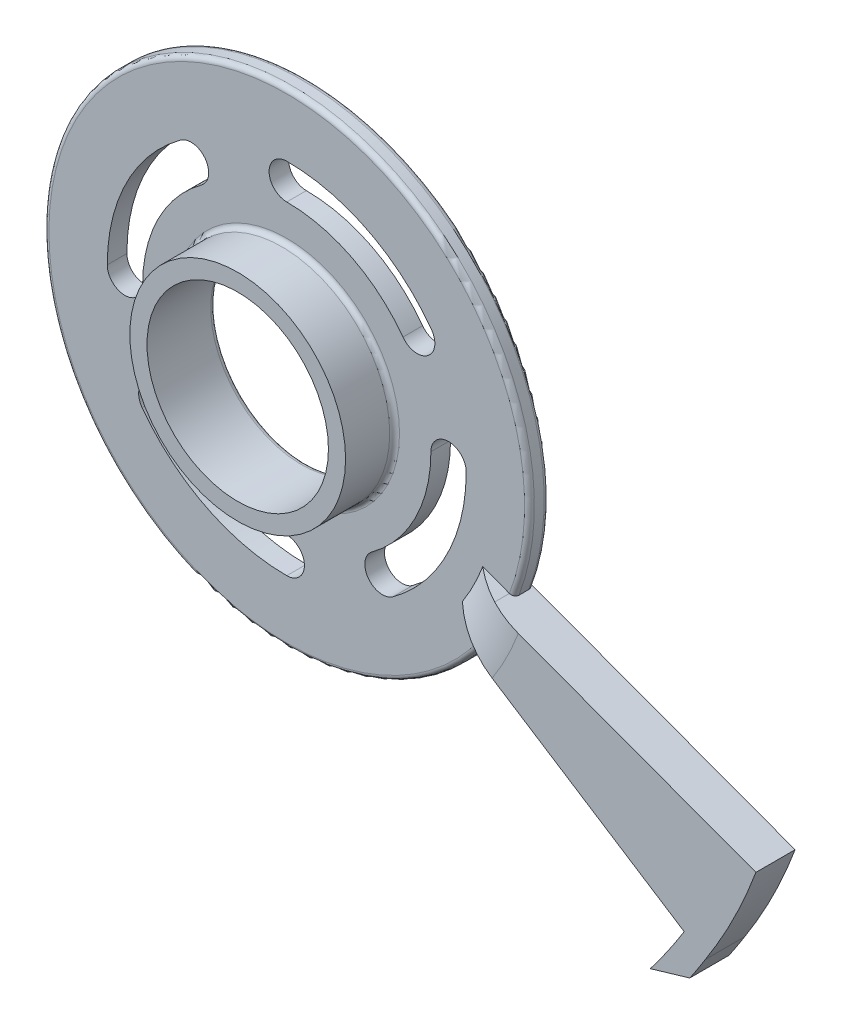
from build123d import *

# Parameters (mm, degrees)
SKETCH3_R                = 24.75
BOSS_EXTRUDE3_DEPTH      = 2
SKETCH7_R                = 9.25
CUT_EXTRUDE2_DEPTH       = 2
BOSS_EXTRUDE6_START      = 5
SKETCH8_R                = 11
SKETCH8_R_2              = 9.25
BOSS_EXTRUDE6_DEPTH      = 5
FILLET31_R               = 0.5
FILLET32_R               = 0.5
CUT_EXTRUDE7_DEPTH       = 2
BOSS_EXTRUDE8_DEPTH      = 2
BOSS_EXTRUDE8_DEPTH_BACK = 2
CUT_EXTRUDE9_START       = -2
CUT_EXTRUDE9_DEPTH       = 2
CUT_EXTRUDE10_START      = -2
CUT_EXTRUDE10_DEPTH      = 2
FILLET33_R               = 0.5
FILLET34_R               = 0.5
CUT_EXTRUDE11_DEPTH      = 4
BOSS_EXTRUDE10_DEPTH     = 4
BOSS_EXTRUDE14_START     = -4
BOSS_EXTRUDE14_DEPTH     = 4
BOSS_EXTRUDE16_DEPTH     = 4
BOSS_EXTRUDE18_DEPTH     = 2
FILLET36_R               = 10
BOSS_EXTRUDE22_DEPTH     = 4


with BuildPart() as part:
    # Sketch3 → Boss-Extrude3 (new body)
    with BuildSketch(Plane.XY):
        Circle(SKETCH3_R)
    extrude(amount=BOSS_EXTRUDE3_DEPTH)

    # Sketch7 → Cut-Extrude2 (cut)
    with BuildSketch(Plane.XY.offset(2)):
        Circle(SKETCH7_R)
    extrude(amount=-CUT_EXTRUDE2_DEPTH, mode=Mode.SUBTRACT)

    # Sketch8 → Boss-Extrude6 (add)
    with BuildSketch(Plane.XY.offset(2).offset(BOSS_EXTRUDE6_START)):
        Circle(SKETCH8_R)
        Circle(SKETCH8_R_2, mode=Mode.SUBTRACT)
    extrude(amount=-BOSS_EXTRUDE6_DEPTH)

    # Fillet31
    fillet31_edges = [part.edges().sort_by_distance(p)[0] for p in [
        (-24.75, 0, 0),
        (-9.25, 0, 0),
    ]]
    fillet(fillet31_edges, radius=FILLET31_R)

    # Fillet32
    fillet32_edges = [part.edges().sort_by_distance(p)[0] for p in [
        (-11, 0, 2),
        (-24.75, 0, 2),
    ]]
    fillet(fillet32_edges, radius=FILLET32_R)

    # Sketch4 → Cut-Extrude7 (cut)
    with BuildSketch(Plane.XY.offset(2)):
        with BuildLine():
            ThreePointArc((-14.7, 0), (-16.5, -1.8), (-18.3, 0))
            ThreePointArc((-18.3, 0), (-16.325580278, 8.268338925), (-10.828368461, 14.752506108))
            ThreePointArc((-10.828368461, 14.752506108), (-8.312216864, 14.366525356), (-8.698197616, 11.850373759))
            ThreePointArc((-8.698197616, 11.850373759), (-13.113990715, 6.641780448), (-14.7, 0))
        make_face()
        with BuildLine():
            ThreePointArc((0, -14.7), (1.8, -16.5), (0, -18.3))
            ThreePointArc((0, -18.3), (-8.268338925, -16.325580278), (-14.752506108, -10.828368461))
            ThreePointArc((-14.752506108, -10.828368461), (-14.366525356, -8.312216864), (-11.850373759, -8.698197616))
            ThreePointArc((-11.850373759, -8.698197616), (-6.641780448, -13.113990715), (0, -14.7))
        make_face()
        with BuildLine():
            ThreePointArc((14.7, 0), (16.5, 1.8), (18.3, 0))
            ThreePointArc((18.3, 0), (16.325580278, -8.268338925), (10.828368461, -14.752506108))
            ThreePointArc((10.828368461, -14.752506108), (8.312216864, -14.366525356), (8.698197616, -11.850373759))
            ThreePointArc((8.698197616, -11.850373759), (13.113990715, -6.641780448), (14.7, 0))
        make_face()
        with BuildLine():
            ThreePointArc((0, 14.7), (-1.8, 16.5), (0, 18.3))
            ThreePointArc((0, 18.3), (8.268338925, 16.325580278), (14.752506108, 10.828368461))
            ThreePointArc((14.752506108, 10.828368461), (14.366525356, 8.312216864), (11.850373759, 8.698197616))
            ThreePointArc((11.850373759, 8.698197616), (6.641780448, 13.113990715), (0, 14.7))
        make_face()
    extrude(amount=-CUT_EXTRUDE7_DEPTH, mode=Mode.SUBTRACT)

    # Sketch13 → Boss-Extrude8 (add, two sides: drawn at the far end of the back side and taken through both)
    with BuildSketch(Plane.XY.offset(2).offset(-BOSS_EXTRUDE8_DEPTH_BACK)):
        with BuildLine():
            Line((38.819540025, -30.398089039), (19.877333475, -13.890792415))
            ThreePointArc((19.877333475, -13.890792415), (21.459544814, -11.29382293), (22.704291658, -8.519251158))
            Line((22.704291658, -8.519251158), (47.195410326, -17.604918534))
            ThreePointArc((47.195410326, -17.604918534), (43.423669833, -24.273992336), (38.819540025, -30.398089039))
        make_face()
    extrude(amount=BOSS_EXTRUDE8_DEPTH + BOSS_EXTRUDE8_DEPTH_BACK)

    # Sketch14 → Cut-Extrude9 (cut)
    with BuildSketch(Plane.XY.offset(4).offset(CUT_EXTRUDE9_START)):
        with BuildLine():
            Line((19.850553041, -13.867978765), (38.819540025, -30.398089039))
            ThreePointArc((38.819540025, -30.398089039), (40.286694805, -28.620798349), (41.683322514, -26.787567215))
            Line((41.683322514, -26.787567215), (20.371088677, -13.091372623))
            ThreePointArc((20.371088677, -13.091372623), (20.11456922, -13.482188107), (19.850553041, -13.867978765))
        make_face()
    extrude(amount=CUT_EXTRUDE9_DEPTH, mode=Mode.SUBTRACT)

    # Sketch15 → Cut-Extrude10 (cut)
    with BuildSketch(Plane.XY.offset(2).offset(CUT_EXTRUDE10_START)):
        with BuildLine():
            Line((38.819540025, -30.398089039), (20.256402439, -14.22113428))
            ThreePointArc((20.256402439, -14.22113428), (20.514190977, -13.846677166), (20.765058212, -13.467548308))
            Line((20.765058212, -13.467548308), (41.683322514, -26.787567215))
            ThreePointArc((41.683322514, -26.787567215), (40.286694805, -28.620798349), (38.819540025, -30.398089039))
        make_face()
    extrude(amount=CUT_EXTRUDE10_DEPTH, mode=Mode.SUBTRACT)

    # Fillet33
    # the kernel refuses this fillet: 0.5 mm, written as the material it takes off along each edge
    with BuildSketch(Plane(origin=(0, 0, 2), x_dir=(0.7883894686157571, -0.6151764346720087, 0), z_dir=(-0.6151764346720087, -0.7883894686157571, 0))) as fillet33_piece_1_section:
        with BuildLine():
            CenterArc((24.75 - FILLET33_R, -FILLET33_R), FILLET33_R, 0, 90)
            Line((24.75 - FILLET33_R, 0), (24.75, 0))
            Line((24.75, 0), (24.75, -FILLET33_R))
        make_face()
    fillet33_piece_1 = revolve(axis=Axis((0, 0, 2), (0, 0, 1)), revolution_arc=7.892324656, mode=Mode.PRIVATE)
    fillet33_piece_1 = split(fillet33_piece_1, bisect_by=Plane(origin=(20.636081205, -13.385420262, 1.886497018), z_dir=(-0.5371164504415562, -0.8435081023114498, 0)), keep=Keep.TOP, mode=Mode.PRIVATE)
    add(fillet33_piece_1, mode=Mode.SUBTRACT)

    # Fillet34
    # the kernel refuses this fillet: 0.5 mm, written as the material it takes off along each edge
    with BuildSketch(Plane(origin=(0, 0, 0), x_dir=(0.7883894686157571, -0.6151764346720087, 0), z_dir=(-0.6151764346720087, -0.7883894686157571, 0))) as fillet34_piece_1_section:
        with BuildLine():
            CenterArc((24.75 - FILLET34_R, FILLET34_R), FILLET34_R, 270, 90)
            Line((24.75, FILLET34_R), (24.75, 0))
            Line((24.75, 0), (24.75 - FILLET34_R, 0))
        make_face()
    fillet34_piece_1 = revolve(axis=Axis((0, 0, 0), (0, 0, 1)), revolution_arc=7.892324656, mode=Mode.PRIVATE)
    fillet34_piece_1 = split(fillet34_piece_1, bisect_by=Plane(origin=(20.636080982, -13.38542012, 0.113502928), z_dir=(-0.5371164504415562, -0.8435081023114498, 0)), keep=Keep.TOP, mode=Mode.PRIVATE)
    add(fillet34_piece_1, mode=Mode.SUBTRACT)

    # Sketch16 → Cut-Extrude11 (cut)
    with BuildSketch(Plane(origin=(0, 0, 0), x_dir=(-1, 0, 0), z_dir=(0, 0, -1))):
        with BuildLine():
            Line((-46.768831726, -17.446667238), (-47.195410326, -17.604918534))
            ThreePointArc((-47.195410326, -17.604918534), (-45.975373397, -19.992187587), (-44.648150349, -22.321570042))
            ThreePointArc((-44.648150349, -22.321570042), (-45.773434679, -19.912370438), (-46.768831726, -17.446667238))
        make_face()
    extrude(amount=-CUT_EXTRUDE11_DEPTH, mode=Mode.SUBTRACT)

    # Sketch17 → Boss-Extrude10 (add)
    with BuildSketch(Plane(origin=(0, 0, 0), x_dir=(-1, 0, 0), z_dir=(0, 0, -1))):
        with BuildLine():
            Line((-41.680315567, -26.785634817), (-41.99318774, -26.986700468))
            ThreePointArc((-41.99318774, -26.986700468), (-43.383421107, -24.68984795), (-44.648150349, -22.321570042))
            ThreePointArc((-44.648150349, -22.321570042), (-43.21497039, -24.587334089), (-41.680315567, -26.785634817))
        make_face()
    extrude(amount=-BOSS_EXTRUDE10_DEPTH)

    # Sketch18 → Boss-Extrude14 (add)
    with BuildSketch(Plane.XY.offset(4).offset(BOSS_EXTRUDE14_START)):
        with BuildLine():
            Line((41.99318774, -26.986700468), (44.742327082, -28.753420356))
            ThreePointArc((44.742327082, -28.753420356), (47.558806026, -23.807456483), (49.830614891, -18.588836286))
            Line((49.830614891, -18.588836286), (46.768831726, -17.446667238))
            ThreePointArc((46.768831726, -17.446667238), (44.636611469, -22.344635492), (41.99318774, -26.986700468))
        make_face()
    extrude(amount=BOSS_EXTRUDE14_DEPTH)

    # Sketch23 → Boss-Extrude16 (add)
    with BuildSketch(Plane(origin=(0, 0, 0), x_dir=(-1, 0, 0), z_dir=(0, 0, -1))):
        with BuildLine():
            Line((-22.705248166, -8.516701574), (-49.833635263, -18.580737641))
            ThreePointArc((-49.833635263, -18.580737641), (-47.534188111, -23.856570908), (-44.678139851, -28.853055892))
            Line((-44.678139851, -28.853055892), (-20.3362292, -13.209855485))
            ThreePointArc((-20.3362292, -13.209855485), (-21.648293625, -10.92766595), (-22.705248166, -8.516701574))
        make_face()
    extrude(amount=-BOSS_EXTRUDE16_DEPTH)

    # Sketch24 → Boss-Extrude18 (add)
    with BuildSketch(Plane.XY.offset(2)):
        with BuildLine():
            Line((22.705248166, -8.516701574), (19.989482511, -7.498022304))
            ThreePointArc((19.989482511, -7.498022304), (19.05894988, -9.620612195), (17.903820956, -11.629829952))
            Line((17.903820956, -11.629829952), (20.3362292, -13.209855485))
            ThreePointArc((20.3362292, -13.209855485), (21.648293625, -10.92766595), (22.705248166, -8.516701574))
        make_face()
    extrude(amount=BOSS_EXTRUDE18_DEPTH)

    # Fillet36
    # the kernel refuses this fillet: 10 mm, written as the material it takes off along each edge
    with BuildSketch(Plane(origin=(0, 0, 4), x_dir=(0.9415001146700814, 0.3370126615963019, 0), z_dir=(-0.3370126615963019, 0.9415001146700814, 0))) as fillet36_piece_1:
        with BuildLine():
            CenterArc((27.349467195, 10), FILLET36_R, 233.130102354, 36.869897646)
            Line((21.349467195, 2), (21.229467195, 1.84))
            ThreePointArc((21.229467195, 1.84), (21.149467195, 1), (21.149467195, 0))
            Line((21.149467195, 0), (21.349467195, -0.2))
            Line((21.349467195, -0.2), (27.349467195, -0.2))
            Line((27.349467195, -0.2), (27.349467195, 0))
        make_face()
    revolve(axis=Axis((0, 0, 4), (0, 0, -1)), revolution_arc=92.95757894, mode=Mode.SUBTRACT)

    # Sketch25 → Boss-Extrude22 (add)
    with BuildSketch(Plane.XY.offset(4)):
        with BuildLine():
            Line((43.093421594, -31.278983813), (39.066364797, -32.470049901))
            ThreePointArc((39.066364797, -32.470049901), (40.85817528, -30.012922175), (42.525112054, -27.469423942))
            Line((42.525112054, -27.469423942), (44.678139851, -28.853055892))
            ThreePointArc((44.678139851, -28.853055892), (43.899627076, -30.075064874), (43.093421594, -31.278983813))
        make_face()
    extrude(amount=-BOSS_EXTRUDE22_DEPTH)


solid = part.part
